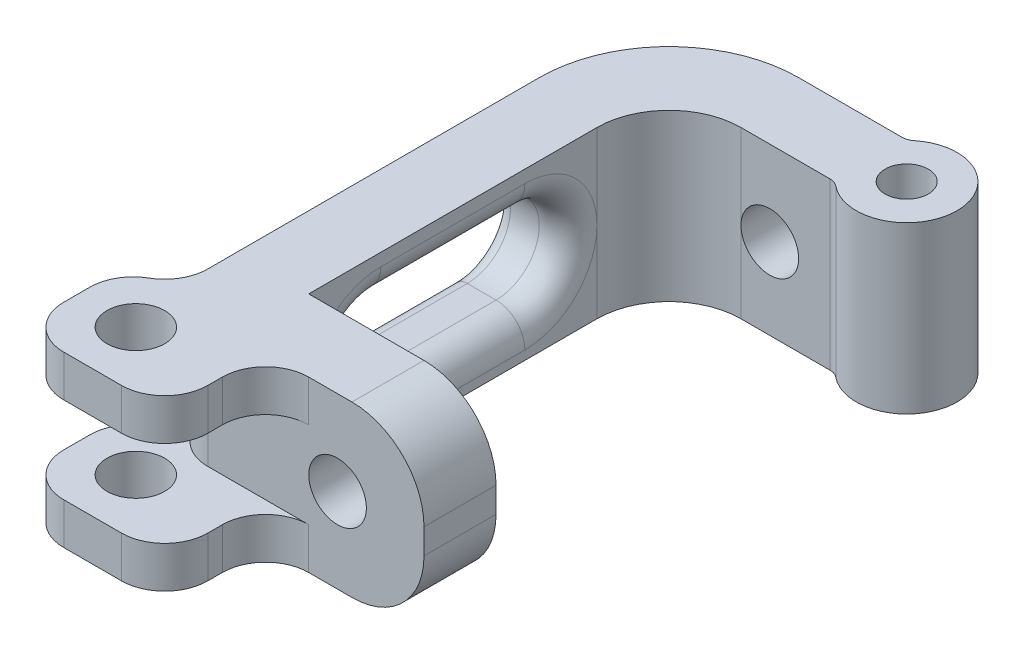
from build123d import *

# Parameters (mm, degrees)
SKETCH1_W               = 20
SKETCH1_H               = 11.5
BOSS_EXTRUDE1_DEPTH     = 5
SKETCH2_W               = 5
SKETCH2_H               = 11.5
BOSS_EXTRUDE2_DEPTH     = 25
SKETCH3_W               = 18
SKETCH3_H               = 11.75
BOSS_EXTRUDE3_DEPTH     = 5
CUT_EXTRUDE1_DEPTH      = 5
CUT_EXTRUDE2_DEPTH      = 33.186953879
CUT_EXTRUDE2_DEPTH_BACK = 33.186953879
SKETCH5_R               = 2
FILLET1_R               = 9
FILLET7_R               = 5
FILLET8_R               = 1
FILLET9_R               = 2
CUT_EXTRUDE4_DEPTH      = 39.173943993
CUT_EXTRUDE4_DEPTH_BACK = 39.173943993
SKETCH10_R              = 1.5
SKETCH10_4_R            = 3.5
SKETCH10_4_R_2          = 1.5
BOSS_EXTRUDE7_DEPTH     = 11.5
FILLET13_R              = 1
FILLET16_R              = 5
SKETCH11_W              = 10
SKETCH11_H              = 2.875
BOSS_EXTRUDE8_DEPTH     = 7
CUT_EXTRUDE5_DEPTH      = 46.508927696
CUT_EXTRUDE5_DEPTH_BACK = 46.508927696
SKETCH12_R              = 2
FILLET17_R              = 3
FILLET18_R              = 3
FILLET19_R              = 3


with BuildPart() as part:
    # Sketch1 → Boss-Extrude1 (new body)
    with BuildSketch(Plane.XY):
        Rectangle(SKETCH1_W, SKETCH1_H)
    extrude(amount=BOSS_EXTRUDE1_DEPTH)

    # Sketch2 → Boss-Extrude2 (add)
    with BuildSketch(Plane.XY.offset(5)):
        with Locations((-7.5, 0)):
            Rectangle(SKETCH2_W, SKETCH2_H)
    extrude(amount=BOSS_EXTRUDE2_DEPTH)

    # Sketch3 → Boss-Extrude3 (add)
    with BuildSketch(Plane.XY.offset(30)):
        with Locations((-1, -0.125)):
            Rectangle(SKETCH3_W, SKETCH3_H)
    extrude(amount=BOSS_EXTRUDE3_DEPTH)

    # Sketch4 → Cut-Extrude1 (cut)
    with BuildSketch(Plane.ZY.offset(10)):
        with BuildLine():
            Line((15, 2.875), (25, 2.875))
            ThreePointArc((25, 2.875), (28, -0.125), (25, -3.125))
            Line((25, -3.125), (15, -3.125))
            ThreePointArc((15, -3.125), (12, -0.125), (15, 2.875))
        make_face()
    extrude(amount=-CUT_EXTRUDE1_DEPTH, mode=Mode.SUBTRACT)

    # Sketch5 → Cut-Extrude2 (cut, two sides: drawn at the far end of the back side and taken through both)
    with BuildSketch(Plane(origin=(0, 0, 30), x_dir=(-1, 0, 0), z_dir=(0, 0, -1)).offset(-CUT_EXTRUDE2_DEPTH_BACK)):
        with Locations((-2, -0.125)):
            Circle(SKETCH5_R)
    extrude(amount=CUT_EXTRUDE2_DEPTH + CUT_EXTRUDE2_DEPTH_BACK, mode=Mode.SUBTRACT)

    # Fillet1
    fillet1_edges = [part.edges().sort_by_distance(p)[0] for p in [
        (-10, 0, 0),
    ]]
    fillet(fillet1_edges, radius=FILLET1_R)

    # Fillet7
    fillet7_edges = [part.edges().sort_by_distance(p)[0] for p in [
        (8, -6, 32.5),
        (8, 5.75, 32.5),
    ]]
    fillet(fillet7_edges, radius=FILLET7_R)

    # Fillet8
    fillet8_edges = [part.edges().sort_by_distance(p)[0] for p in [
        (-10, -0.125, 12),
        (-10, -3.125, 20),
        (-10, -0.125, 28),
        (-10, 2.875, 20),
    ]]
    fillet(fillet8_edges, radius=FILLET8_R)

    # Fillet9
    fillet9_edges = [part.edges().sort_by_distance(p)[0] for p in [
        (-5, -0.125, 12),
        (-5, 2.875, 20),
        (-5, -0.125, 28),
        (-5, -3.125, 20),
    ]]
    fillet(fillet9_edges, radius=FILLET9_R - 0.0001)  # a hair under: the kernel refuses the full size

    # Sketch10 → Cut-Extrude4 (cut, two sides: drawn at the far end of the back side and taken through both)
    with BuildSketch(Plane.XZ.offset(5.75).offset(-CUT_EXTRUDE4_DEPTH_BACK)):
        with Locations((9, 2.5)):
            Circle(SKETCH10_R)
    extrude(amount=CUT_EXTRUDE4_DEPTH + CUT_EXTRUDE4_DEPTH_BACK, mode=Mode.SUBTRACT)

    # Sketch10<4> → Boss-Extrude7 (add)
    with BuildSketch(Plane.XZ.offset(5.75)):
        with Locations((9, 2.5)):
            Circle(SKETCH10_4_R)
        with Locations(Location((9, 2.5, 0), (0, 0, 270))):
            Circle(SKETCH10_4_R_2, mode=Mode.SUBTRACT)
    extrude(amount=-BOSS_EXTRUDE7_DEPTH)

    # Fillet13
    fillet13_edges = [part.edges().sort_by_distance(p)[0] for p in [
        (6.550510257, 0, 0),
        (6.550510257, 0, 5),
    ]]
    fillet(fillet13_edges, radius=FILLET13_R)

    # Fillet16
    fillet16_edges = [part.edges().sort_by_distance(p)[0] for p in [
        (-5, 0, 5),
    ]]
    fillet(fillet16_edges, radius=FILLET16_R - 0.0001)  # a hair under: the kernel refuses the full size

    # Sketch11 → Boss-Extrude8 (add)
    with BuildSketch(Plane.XY.offset(35)):
        with Locations((-8, 4.3125)):
            Rectangle(SKETCH11_W, SKETCH11_H)
        with Locations((-8, -4.5625)):
            Rectangle(SKETCH11_W, SKETCH11_H)
    extrude(amount=BOSS_EXTRUDE8_DEPTH)

    # Sketch12 → Cut-Extrude5 (cut, two sides: drawn at the far end of the back side and taken through both)
    with BuildSketch(Plane(origin=(0, 5.75, 0), x_dir=(1, 0, 0), z_dir=(0, 1, 0)).offset(-CUT_EXTRUDE5_DEPTH_BACK)):
        with Locations(Location((-9, -38, 0), (0, 0, 90))):
            Circle(SKETCH12_R)
    extrude(amount=CUT_EXTRUDE5_DEPTH + CUT_EXTRUDE5_DEPTH_BACK, mode=Mode.SUBTRACT)

    # Fillet17
    fillet17_edges = [part.edges().sort_by_distance(p)[0] for p in [
        (-10, -4.5625, 35),
        (-3, 4.3125, 35),
        (-3, -4.5625, 35),
        (-10, 4.3125, 35),
    ]]
    fillet(fillet17_edges, radius=FILLET17_R - 0.0001)  # a hair under: the kernel refuses the full size
    fillet17_2_edges = [part.edges().sort_by_distance(p)[0] for p in [
        (-13, 4.3125, 42),
        (-3, 4.3125, 42),
        (-3, -4.5625, 42),
        (-13, -4.5625, 42),
    ]]
    fillet(fillet17_2_edges, radius=FILLET17_R)

    # Fillet18
    fillet18_edges = [part.edges().sort_by_distance(p)[0] for p in [
        (-13, 4.3125, 35),
        (-13, -4.5625, 35),
    ]]
    fillet(fillet18_edges, radius=FILLET18_R)

    # Fillet19
    fillet19_edges = [part.edges().sort_by_distance(p)[0] for p in [
        (-10, -0.125, 35),
    ]]
    fillet(fillet19_edges, radius=FILLET19_R - 0.0001)  # a hair under: the kernel refuses the full size


solid = part.part
